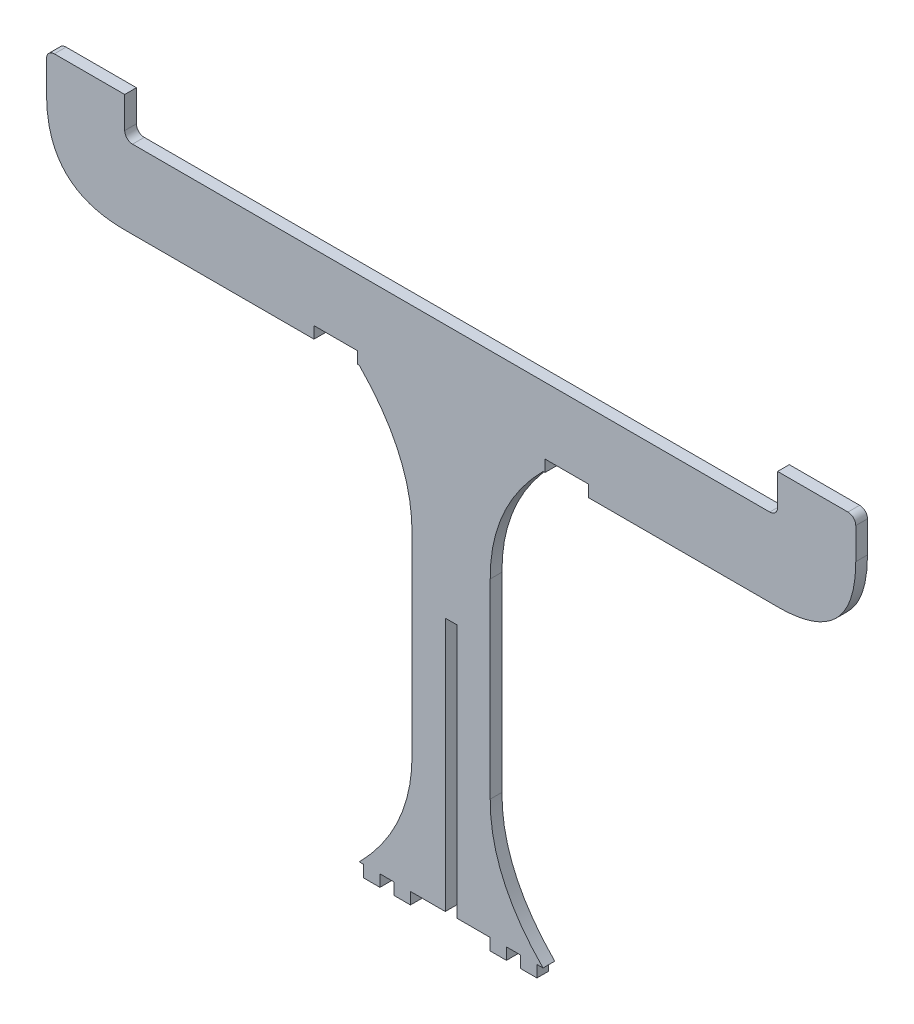
from build123d import *

# Parameters (mm, degrees)
P_IDAT_VYSUNUT_M2_DEPTH  = 3
SKICA2_W                 = 3
SKICA2_H                 = 65
SKICA2_W_2               = 11.08
SKICA2_H_2               = 11.388513514
ODEBRAT_VYSUNUT_M1_DEPTH = 3


with BuildPart() as part:
    # Skica1 → Přidat vysunutím2 (new body)
    with BuildSketch(Plane.XY):
        with BuildLine():
            Line((-90.642636358, 2.694256757), (-30.642636358, 2.694256757))
            add(Edge.make_bspline(
                [(-30.642636358, 2.694256757), (-17.025139471, -11.118063286), (-17.142636358, -27.878389443)],
                knots=[0, 0, 0, 1, 1, 1], degree=2))
            Line((-17.142636358, -27.878389443), (-17.142636358, -76.655981804))
            add(Edge.make_bspline(
                [(-30.642636358, -107.305743243), (-17.009316786, -93.458261678), (-17.142636358, -76.655981804)],
                knots=[0, 0, 0, 1, 1, 1], degree=2))
            Line((-30.642636358, -107.305743243), (-29.497972973, -107.305743243))
            Line((-29.497972973, -107.305743243), (-29.497972973, -110.305743243))
            Line((-29.497972973, -110.305743243), (-25.347972973, -110.305743243))
            Line((-25.347972973, -110.305743243), (-25.347972973, -107.305743243))
            Line((-25.347972973, -107.305743243), (-21.697972973, -107.305743243))
            Line((-21.697972973, -107.305743243), (-21.697972973, -110.305743243))
            Line((-21.697972973, -110.305743243), (-17.547972973, -110.305743243))
            Line((-17.547972973, -110.305743243), (-17.547972973, -107.305743243))
            Line((-17.547972973, -107.305743243), (2.852027027, -107.305743243))
            Line((2.852027027, -107.305743243), (2.852027027, -110.305743243))
            Line((2.852027027, -110.305743243), (7.002027027, -110.305743243))
            Line((7.002027027, -110.305743243), (7.002027027, -107.305743243))
            Line((7.002027027, -107.305743243), (10.652027027, -107.305743243))
            Line((10.652027027, -107.305743243), (10.652027027, -110.305743243))
            Line((10.652027027, -110.305743243), (14.802027027, -110.305743243))
            Line((14.802027027, -110.305743243), (14.802027027, -107.305743243))
            Line((14.802027027, -107.305743243), (16.357363642, -107.305743243))
            add(Edge.make_bspline(
                [(16.357363642, -107.305743243), (2.72404407, -93.458261678), (2.857363642, -76.655981804)],
                knots=[0, 0, 0, 1, 1, 1], degree=2))
            Line((2.857363642, -76.655981804), (2.857363642, -27.878389443))
            add(Edge.make_bspline(
                [(16.357363642, 2.694256757), (2.739866756, -11.118063286), (2.857363642, -27.878389443)],
                knots=[0, 0, 0, 1, 1, 1], degree=2))
            Line((16.357363642, 2.694256757), (76.357363642, 2.694256757))
            add(Edge.make_bspline(
                [(96.357363642, 22.694256757), (96.357363642, 2.694256757), (76.357363642, 2.694256757)],
                knots=[0, 0, 0, 1, 1, 1], degree=2))
            Line((96.357363642, 22.694256757), (96.357363642, 30.694256757))
            ThreePointArc((96.357363642, 30.694256757), (95.771577204, 32.108470319), (94.357363642, 32.694256757))
            Line((94.357363642, 32.694256757), (76.357363642, 32.694256757))
            Line((76.357363642, 32.694256757), (76.357363642, 24.694256757))
            ThreePointArc((76.357363642, 24.694256757), (75.771577204, 23.280043194), (74.357363642, 22.694256757))
            Line((74.357363642, 22.694256757), (-88.642636358, 22.694256757))
            ThreePointArc((-88.642636358, 22.694256757), (-90.05684992, 23.280043194), (-90.642636358, 24.694256757))
            Line((-90.642636358, 24.694256757), (-90.642636358, 32.694256757))
            Line((-90.642636358, 32.694256757), (-108.642636358, 32.694256757))
            ThreePointArc((-108.642636358, 32.694256757), (-110.05684992, 32.108470319), (-110.642636358, 30.694256757))
            Line((-110.642636358, 30.694256757), (-110.642636358, 22.694256757))
            add(Edge.make_bspline(
                [(-110.642636358, 22.694256757), (-110.642636358, 2.694256757), (-90.642636358, 2.694256757)],
                knots=[0, 0, 0, 1, 1, 1], degree=2))
        make_face()
    extrude(amount=P_IDAT_VYSUNUT_M2_DEPTH)

    # Skica2 → Odebrat vysunutím1 (cut)
    with BuildSketch(Plane(origin=(0, 0, 0), x_dir=(-1, 0, 0), z_dir=(0, 0, -1))):
        with Locations((7.142636358, -74.805743243)):
            Rectangle(SKICA2_W, SKICA2_H)
        with Locations((36.682636358, 0)):
            Rectangle(SKICA2_W_2, SKICA2_H_2)
        with Locations((-22.397363642, 0)):
            Rectangle(SKICA2_W_2, SKICA2_H_2)
    extrude(amount=-ODEBRAT_VYSUNUT_M1_DEPTH, mode=Mode.SUBTRACT)


solid = part.part
